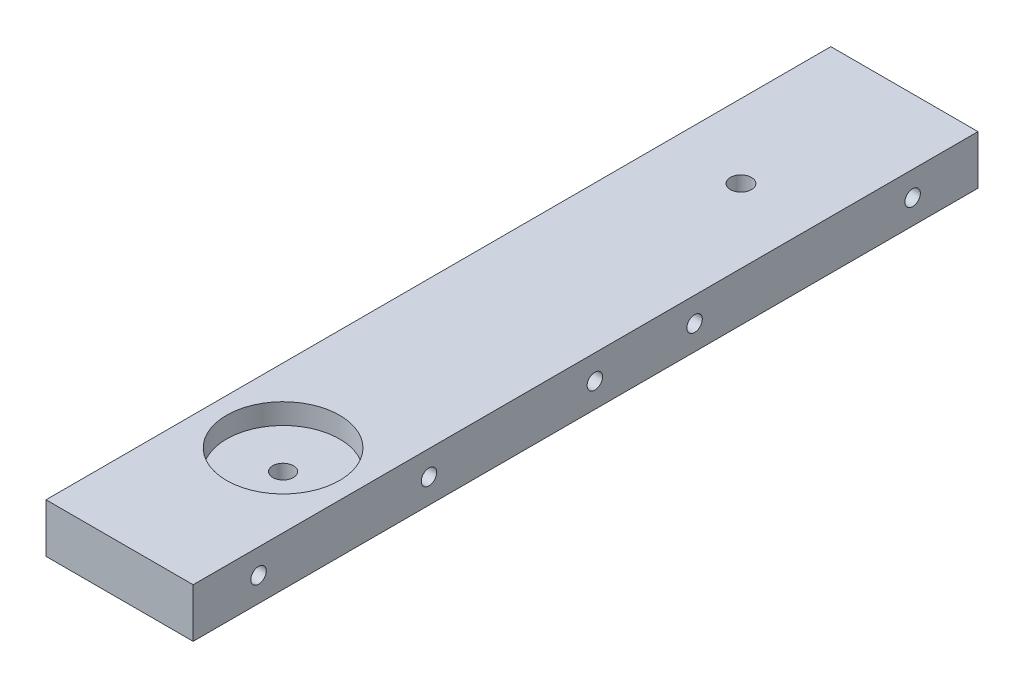
from build123d import *

# Parameters (mm, degrees)
SKETCH2_W             = 28.575
SKETCH2_H             = 152.4
BOSS_EXTRUDE1_DEPTH   = 9.525
F_3_0MM_DOWEL_HOLE1_D = 3
LPATTERN1_COUNT       = 4
LPATTERN1_PITCH       = 42.333333333
F_3_0MM_DOWEL_HOLE2_D = 3
SKETCH12_R            = 2.05
CUT_EXTRUDE1_DEPTH    = 156.348048749
SKETCH12_4_R          = 10.975
CUT_EXTRUDE2_DEPTH    = 4
SKETCH15_R            = 2
CUT_EXTRUDE3_DEPTH    = 156.154169296


with BuildPart() as part:
    # Sketch2 → Boss-Extrude1 (new body)
    with BuildSketch(Plane(origin=(0, 0, 0), x_dir=(1, 0, 0), z_dir=(0, 1, 0))):
        with Locations((14.2875, 76.2)):
            Rectangle(SKETCH2_W, SKETCH2_H)
    extrude(amount=BOSS_EXTRUDE1_DEPTH)

    # Ø3.0mm Dowel Hole1 (through all)
    with Locations(Plane.ZY):
        with Locations((-139.7, 4.7625)):
            f_3_0mm_dowel_hole1 = Hole(F_3_0MM_DOWEL_HOLE1_D / 2)

    # LPattern1: Ø3.0mm Dowel Hole1 ×4, 1 skipped
    with Locations(*[(0, 0, i * LPATTERN1_PITCH) for i in range(1, LPATTERN1_COUNT) if i not in (2,)]):
        add(f_3_0mm_dowel_hole1, mode=Mode.SUBTRACT)

    # Ø3.0mm Dowel Hole2 (through all)
    with Locations(Plane.ZY):
        with Locations((-78, 4.7625), (-45.79, 4.7625)):
            Hole(F_3_0MM_DOWEL_HOLE2_D / 2)

    # Sketch12 → Cut-Extrude1 (cut, through all)
    with BuildSketch(Plane(origin=(0, 9.525, 0), x_dir=(1, 0, 0), z_dir=(0, 1, 0))):
        with Locations((14.2875, 120.65)):
            Circle(SKETCH12_R)
    extrude(amount=-CUT_EXTRUDE1_DEPTH, mode=Mode.SUBTRACT)

    # Sketch12<4> → Cut-Extrude2 (cut)
    with BuildSketch(Plane(origin=(0, 9.525, 0), x_dir=(1, 0, 0), z_dir=(0, 1, 0))):
        with Locations((14.2875, 31.75)):
            Circle(SKETCH12_4_R)
    extrude(amount=-CUT_EXTRUDE2_DEPTH, mode=Mode.SUBTRACT)

    # Sketch15 → Cut-Extrude3 (cut, through all)
    with BuildSketch(Plane(origin=(0, 5.525, 0), x_dir=(1, 0, 0), z_dir=(0, 1, 0))):
        with Locations((14.2875, 31.75)):
            Circle(SKETCH15_R)
    extrude(amount=-CUT_EXTRUDE3_DEPTH, mode=Mode.SUBTRACT)


solid = part.part
